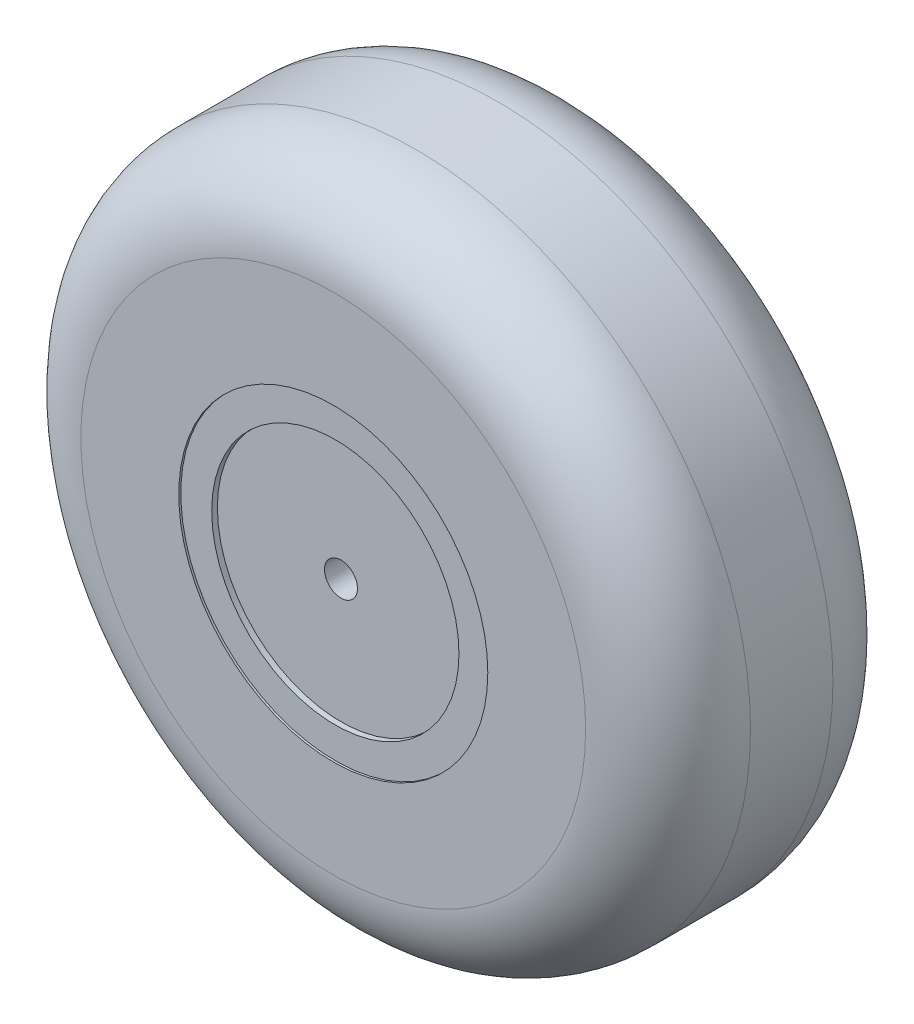
from build123d import *

# Parameters (mm, degrees)
SKETCH1_R            = 32.5
SKETCH1_R_2          = 1.6
BOSS_EXTRUDE1_DEPTH  = 24
FILLET2_R            = 8
SKETCH3_R            = 5
BOSS_EXTRUDE2_DEPTH  = 0.75
BOSS_EXTRUDE3_START  = 0.75
SKETCH4_R            = 5
BOSS_EXTRUDE3_DEPTH  = 0.75
SKETCH5_R            = 1.6
CUT_EXTRUDE1_DEPTH   = 40.75
SKETCH6_R            = 15
SKETCH6_R_2          = 12
CUT_EXTRUDE3_DEPTH   = 0.2
CUT_EXTRUDE5_START   = -0.75
SKETCH9_R            = 12
CUT_EXTRUDE5_DEPTH   = 0.75
SKETCH11_R           = 12
CUT_EXTRUDE6_DEPTH   = 0.75
SKETCH12_R           = 15
SKETCH12_R_2         = 12
CUT_EXTRUDE7_DEPTH   = 0.75
SCALE1_START         = 24
SCALE1_OUTLINE_R     = 2.8
SCALE1_OUTLINE_R_2   = 1.6
SCALE1_DEPTH         = 0.75
SCALE1_START_2       = 23.71875
SCALE1_2_OUTLINE_R   = 8.75
SCALE1_2_OUTLINE_R_2 = 2.8
SCALE1_2_DEPTH       = 1.3125
SCALE1_3_OUTLINE_W   = 1.2
SCALE1_3_OUTLINE_H   = 22.5
SCALE1_START_3       = -0.75
SCALE1_5_OUTLINE_R   = 2.8
SCALE1_5_OUTLINE_R_2 = 1.6
SCALE1_5_DEPTH       = 0.75
SCALE1_START_4       = -1.03125
SCALE1_6_OUTLINE_R   = 8.75
SCALE1_6_OUTLINE_R_2 = 2.8
SCALE1_6_DEPTH       = 1.3125


# Read off the part's stored shape, not the designer's step: Scale1
with BuildPart() as part:
    # Sketch1 → Boss-Extrude1 (new body)
    with BuildSketch(Plane.XY):
        Circle(SKETCH1_R)
        Circle(SKETCH1_R_2, mode=Mode.SUBTRACT)
    extrude(amount=BOSS_EXTRUDE1_DEPTH)

    # Fillet2
    fillet2_edges = [part.edges().sort_by_distance(p)[0] for p in [
        (-32.5, 0, 0),
        (-32.5, 0, 24),
    ]]
    fillet(fillet2_edges, radius=FILLET2_R)

    # Sketch3 → Boss-Extrude2 (add)
    with BuildSketch(Plane.XY.offset(24)):
        Circle(SKETCH3_R)
    extrude(amount=BOSS_EXTRUDE2_DEPTH)

    # Sketch4 → Boss-Extrude3 (add)
    with BuildSketch(Plane(origin=(0, 0, 0), x_dir=(-1, 0, 0), z_dir=(0, 0, -1)).offset(BOSS_EXTRUDE3_START)):
        with Locations(Location((0, 0, 0), (0, 0, 180))):
            Circle(SKETCH4_R)
    extrude(amount=-BOSS_EXTRUDE3_DEPTH)

    # Sketch5 → Cut-Extrude1 (cut)
    with BuildSketch(Plane(origin=(0, 0, -0.75), x_dir=(-1, 0, 0), z_dir=(0, 0, -1))):
        Circle(SKETCH5_R)
    extrude(amount=-CUT_EXTRUDE1_DEPTH, mode=Mode.SUBTRACT)

    # Sketch6 → Cut-Extrude3 (cut)
    with BuildSketch(Plane.XY.offset(24)):
        Circle(SKETCH6_R)
        Circle(SKETCH6_R_2, mode=Mode.SUBTRACT)
    extrude(amount=-CUT_EXTRUDE3_DEPTH, mode=Mode.SUBTRACT)

    # Sketch9 → Cut-Extrude5 (cut)
    with BuildSketch(Plane(origin=(0, 0, 0), x_dir=(-1, 0, 0), z_dir=(0, 0, -1)).offset(CUT_EXTRUDE5_START)):
        with Locations(Location((0, 0, 0), (0, 0, 180))):
            Circle(SKETCH9_R)
    extrude(amount=CUT_EXTRUDE5_DEPTH, mode=Mode.SUBTRACT)


with BuildPart() as cut_extrude5_piece_1:
    # of the separate pieces the step leaves, piece 1, a body of its own (cut_extrude5_pieces)
    add(part.part.solids().sort_by_distance((32.5, 0, 8))[0])

    # Sketch11 → Cut-Extrude6 (cut)
    with BuildSketch(Plane.XY.offset(24)):
        with Locations(Location((0, 0, 0), (0, 0, 180))):
            Circle(SKETCH11_R)
    extrude(amount=-CUT_EXTRUDE6_DEPTH, mode=Mode.SUBTRACT)


with BuildPart() as cut_extrude5_piece_2:
    # of the separate pieces the step leaves, piece 2, a body of its own (cut_extrude5_pieces)
    add(part.part.solids().sort_by_distance((5, 0, -0.75))[0])

    # Scale1 5 outline → Scale1 5 (cut)
    with BuildSketch(Plane.XY.offset(SCALE1_START_3)):
        Circle(SCALE1_5_OUTLINE_R)
        Circle(SCALE1_5_OUTLINE_R_2, mode=Mode.SUBTRACT)
    extrude(amount=SCALE1_5_DEPTH, mode=Mode.SUBTRACT)

    # Scale1 6 outline → Scale1 6 (add)
    with BuildSketch(Plane.XY.offset(SCALE1_START_4)):
        Circle(SCALE1_6_OUTLINE_R)
        Circle(SCALE1_6_OUTLINE_R_2, mode=Mode.SUBTRACT)
    extrude(amount=SCALE1_6_DEPTH)


with BuildPart() as cut_extrude6_piece_1:
    # of the separate pieces the step leaves, piece 1, a body of its own (cut_extrude6_pieces)
    add(cut_extrude5_piece_1.part.solids().sort_by_distance((32.5, 0, 8))[0])

    # Sketch12 → Cut-Extrude7 (cut)
    with BuildSketch(Plane(origin=(0, 0, 0), x_dir=(-1, 0, 0), z_dir=(0, 0, -1))):
        with Locations(Location((0, 0, 0), (0, 0, 180))):
            Circle(SKETCH12_R)
        with Locations(Location((0, 0, 0), (0, 0, 180))):
            Circle(SKETCH12_R_2, mode=Mode.SUBTRACT)
    extrude(amount=-CUT_EXTRUDE7_DEPTH, mode=Mode.SUBTRACT)

    # Scale1 3 outline → Scale1 3 (revolve, cut)
    with BuildSketch(Plane.XZ):
        with Locations((2.2, 12)):
            Rectangle(SCALE1_3_OUTLINE_W, SCALE1_3_OUTLINE_H)
    revolve(axis=Axis((0, 0, 0), (0, 0, 1)), mode=Mode.SUBTRACT)

    # Scale1 4 outline → Scale1 4 (revolve)
    with BuildSketch(Plane.XZ):
        with BuildLine():
            Line((2.8, 31.670981604), (2.8, 23.25))
            Line((2.8, 23.25), (12, 23.25))
            Line((12, 23.25), (12, 23.8))
            Line((12, 23.8), (15, 23.8))
            Line((15, 23.8), (15, 24))
            Line((15, 24), (24.5, 24))
            ThreePointArc((24.5, 24), (30.156854249, 21.656854249), (32.5, 16))
            Line((32.5, 16), (32.5, 8))
            ThreePointArc((32.5, 8), (30.156854249, 2.343145751), (24.5, 0))
            Line((24.5, 0), (15, 0))
            Line((15, 0), (15, 0.75))
            Line((15, 0.75), (2.8, 0.75))
            Line((2.8, 0.75), (2.8, -7.704018396))
            Line((2.8, -7.704018396), (26.25, -7.704018396))
            Line((26.25, -7.704018396), (26.25, -9.016518396))
            Line((26.25, -9.016518396), (42.875, -9.016518396))
            ThreePointArc((42.875, -9.016518396), (52.774494937, -4.916013333), (56.875, 4.983481604))
            Line((56.875, 4.983481604), (56.875, 18.983481604))
            ThreePointArc((56.875, 18.983481604), (52.774494937, 28.882976541), (42.875, 32.983481604))
            Line((42.875, 32.983481604), (26.25, 32.983481604))
            Line((26.25, 32.983481604), (26.25, 32.633481604))
            Line((26.25, 32.633481604), (21, 32.633481604))
            Line((21, 32.633481604), (21, 31.670981604))
            Line((21, 31.670981604), (2.8, 31.670981604))
        make_face()
    revolve(axis=Axis((0, 0, 0), (0, 0, 1)))


with BuildPart() as cut_extrude6_piece_2:
    # of the separate pieces the step leaves, piece 2, a body of its own (cut_extrude6_pieces)
    add(cut_extrude5_piece_1.part.solids().sort_by_distance((-1.6, 0, 24))[0])

    # Scale1 outline → Scale1 (cut)
    with BuildSketch(Plane.XY.offset(SCALE1_START)):
        Circle(SCALE1_OUTLINE_R)
        Circle(SCALE1_OUTLINE_R_2, mode=Mode.SUBTRACT)
    extrude(amount=SCALE1_DEPTH, mode=Mode.SUBTRACT)

    # Scale1 2 outline → Scale1 2 (add)
    with BuildSketch(Plane.XY.offset(SCALE1_START_2)):
        Circle(SCALE1_2_OUTLINE_R)
        Circle(SCALE1_2_OUTLINE_R_2, mode=Mode.SUBTRACT)
    extrude(amount=SCALE1_2_DEPTH)


solid = Compound([cut_extrude5_piece_2.part, cut_extrude6_piece_1.part, cut_extrude6_piece_2.part])
